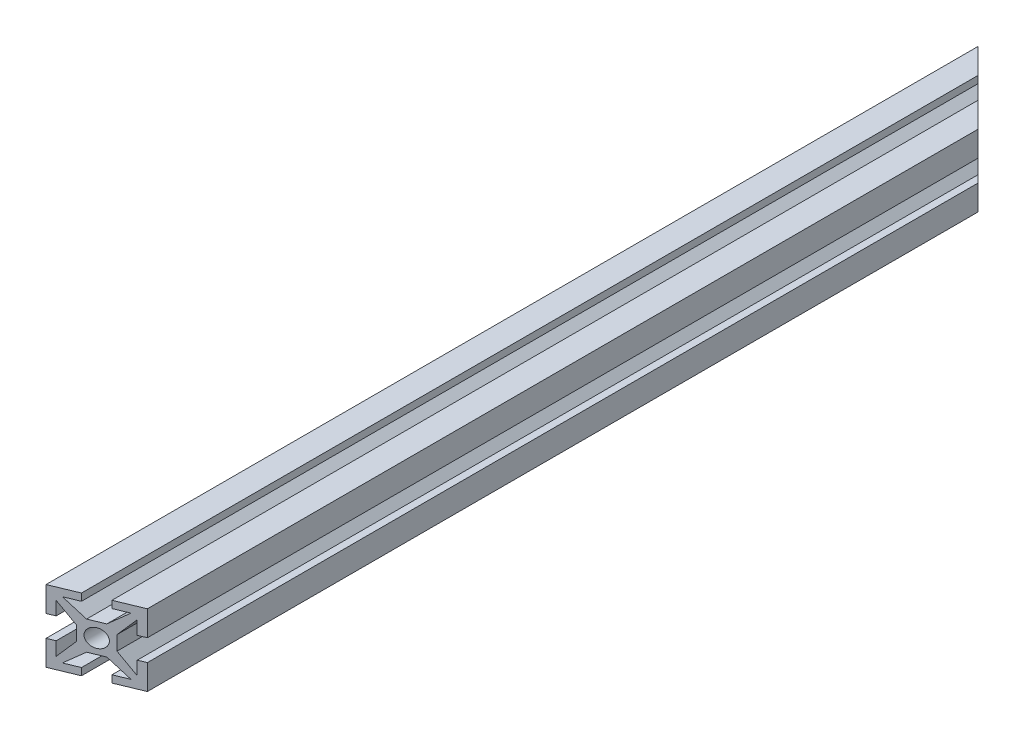
from build123d import *

# Parameters (mm, degrees)
ESQUISSE2_R             = 1.25
BOSS_EXTRU_1_DEPTH      = 130
ENL_V_MAT_EXTRU_1_DEPTH = 131.479883507


with BuildPart() as part:
    # Esquisse2 → Boss.-Extru.1 (new body)
    with BuildSketch(Plane.XY):
        Polygon((-1, -2), (1, -2), (3.383507185, -4), (1.5, -4), (1.5, -5), (5, -5), (5, -1.5), (4, -1.5), (4, -3.383507185), (2, -1), (2, 1), (4, 3.383507185), (4, 1.5), (5, 1.5), (5, 5), (1.5, 5), (1.5, 4), (3.383507185, 4), (1, 2), (-1, 2), (-3.383507185, 4), (-1.5, 4), (-1.5, 5), (-5, 5), (-5, 1.5), (-4, 1.5), (-4, 3.383507185), (-2, 1), (-2, -1), (-4, -3.383507185), (-4, -1.5), (-5, -1.5), (-5, -5), (-1.5, -5), (-1.5, -4), (-3.383507185, -4), align=None)
        Circle(ESQUISSE2_R, mode=Mode.SUBTRACT)
    extrude(amount=BOSS_EXTRU_1_DEPTH)

    # Esquisse3 → Enlèv. mat.-Extru.1 (cut, through all)
    with BuildSketch(Plane(origin=(0, 5, 0), x_dir=(1, 0, 0), z_dir=(0, 1, 0))):
        Polygon((-5, 0), (5, 0), (5, -10), align=None)
        Polygon((5, -125.857864376), (-5, -130), (5, -130), align=None)
    extrude(amount=-ENL_V_MAT_EXTRU_1_DEPTH, mode=Mode.SUBTRACT)


solid = part.part
